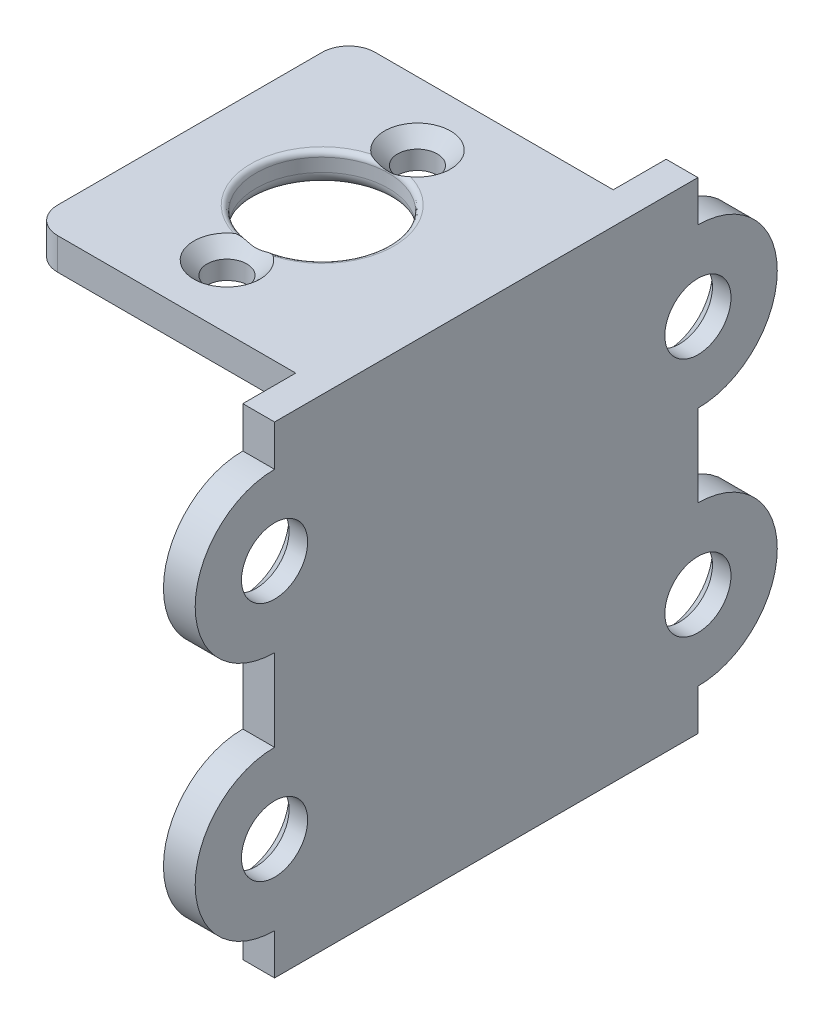
from build123d import *

# Parameters (mm, degrees)
SKETCH1_R           = 0.75
SKETCH1_R_2         = 2.5
BOSS_EXTRUDE3_DEPTH = 1.2
FILLET10_R          = 1
FILLET11_R          = 1
BOSS_EXTRUDE5_DEPTH = 1.2
SKETCH6_R           = 1.25
CUT_EXTRUDE3_DEPTH  = 1.2
SKETCH7_R           = 1.25
CUT_EXTRUDE4_DEPTH  = 1.2
CHAMFER5_SIZE       = 0.5
CHAMFER6_SIZE       = 0.5
FILLET13_R          = 0.5
FILLET14_R          = 0.2
CHAMFER7_SIZE       = 0.5
CHAMFER8_SIZE       = 0.5


with BuildPart() as part:
    # Sketch1 → Boss-Extrude3 (new body)
    with BuildSketch(Plane(origin=(0, 0, 0), x_dir=(1, 0, 0), z_dir=(0, 1, 0))):
        Polygon((5, 6), (0, 6), (-5, 6), (-5, -6), (5, -6), align=None)
        with Locations(Location((0, -3.6, 0), (0, 0, 270))):
            Circle(SKETCH1_R, mode=Mode.SUBTRACT)
        with Locations(Location((0, 0, 0), (0, 0, 270))):
            Circle(SKETCH1_R_2, mode=Mode.SUBTRACT)
        with Locations(Location((0, 3.6, 0), (0, 0, 270))):
            Circle(SKETCH1_R, mode=Mode.SUBTRACT)
    extrude(amount=BOSS_EXTRUDE3_DEPTH)

    # Fillet10
    fillet10_edges = [part.edges().sort_by_distance(p)[0] for p in [
        (-5, 0.6, 6),
    ]]
    fillet(fillet10_edges, radius=FILLET10_R)

    # Fillet11
    fillet11_edges = [part.edges().sort_by_distance(p)[0] for p in [
        (-5, 0.6, -6),
    ]]
    fillet(fillet11_edges, radius=FILLET11_R)

    # Sketch5 → Boss-Extrude5 (add)
    with BuildSketch(Plane(origin=(5, 0, 0), x_dir=(0, 0, -1), z_dir=(1, 0, 0))):
        with BuildLine():
            Line((6, 1.2), (-6, 1.2))
            Line((-6, 1.2), (-8, 1.2))
            Line((-8, 1.2), (-8, -0.35))
            ThreePointArc((-8, -0.35), (-11, -3.35), (-8, -6.35))
            Line((-8, -6.35), (-8, -9.45))
            ThreePointArc((-8, -9.45), (-11, -12.45), (-8, -15.45))
            Line((-8, -15.45), (-8, -17))
            Line((-8, -17), (8, -17))
            Line((8, -17), (8, -15.45))
            ThreePointArc((8, -15.45), (11, -12.45), (8, -9.45))
            Line((8, -9.45), (8, -6.35))
            ThreePointArc((8, -6.35), (11, -3.35), (8, -0.35))
            Line((8, -0.35), (8, 1.2))
            Line((8, 1.2), (6, 1.2))
        make_face()
    extrude(amount=BOSS_EXTRUDE5_DEPTH)

    # Sketch6 → Cut-Extrude3 (cut)
    with BuildSketch(Plane(origin=(6.2, 0, 0), x_dir=(0, 0, -1), z_dir=(1, 0, 0))):
        with Locations((8, -3.35)):
            Circle(SKETCH6_R)
        with Locations((8, -12.45)):
            Circle(SKETCH6_R)
    extrude(amount=-CUT_EXTRUDE3_DEPTH, mode=Mode.SUBTRACT)

    # Sketch7 → Cut-Extrude4 (cut)
    with BuildSketch(Plane.ZY.offset(-5)):
        with Locations((8, -12.45)):
            Circle(SKETCH7_R)
        with Locations((8, -3.35)):
            Circle(SKETCH7_R)
    extrude(amount=-CUT_EXTRUDE4_DEPTH, mode=Mode.SUBTRACT)

    # Chamfer5
    chamfer5_edges = [part.edges().sort_by_distance(p)[0] for p in [
        (5, -3.35, 6.75),
    ]]
    chamfer(chamfer5_edges, length=CHAMFER5_SIZE)

    # Chamfer6
    chamfer6_edges = [part.edges().sort_by_distance(p)[0] for p in [
        (5, -3.35, -6.75),
        (5, -12.45, -6.75),
        (5, -12.45, 6.75),
    ]]
    chamfer(chamfer6_edges, length=CHAMFER6_SIZE)

    # Fillet13
    # the kernel refuses this fillet: 0.5 mm, written as the material it takes off along each edge
    with BuildSketch(Plane(origin=(0, 0, 0), x_dir=(0, 0, 1), z_dir=(-1, 0, 0))) as fillet13_piece_1:
        with BuildLine():
            CenterArc((2.5 + FILLET13_R, FILLET13_R), FILLET13_R, 180, 90)
            Line((2.5, FILLET13_R), (2.5, 0))
            Line((2.5, 0), (2.5 + FILLET13_R, 0))
        make_face()
    revolve(axis=Axis((0, 0, 0), (0, 1, 0)), mode=Mode.SUBTRACT)

    # Fillet14
    fillet14_edges = [part.edges().sort_by_distance(p)[0] for p in [
        (0, 1.2, -2.5),
    ]]
    fillet(fillet14_edges, radius=FILLET14_R)

    # Chamfer7
    # the kernel refuses this chamfer: 0.5 mm, written as the material it takes off along each edge
    with BuildSketch(Plane(origin=(0, 1.2, 3.6), x_dir=(0, 0, 1), z_dir=(-1, 0, 0))) as chamfer7_piece_1:
        Polygon((0.75 + CHAMFER7_SIZE, 0), (0.75, -CHAMFER7_SIZE), (0.75, 0), align=None)
    revolve(axis=Axis((0, 1.2, 3.6), (0, 1, 0)), mode=Mode.SUBTRACT)

    # Chamfer8
    # the kernel refuses this chamfer: 0.5 mm, written as the material it takes off along each edge
    with BuildSketch(Plane(origin=(0, 1.2, -3.6), x_dir=(0, 0, 1), z_dir=(-1, 0, 0))) as chamfer8_piece_1:
        Polygon((0.75 + CHAMFER8_SIZE, 0), (0.75, -CHAMFER8_SIZE), (0.75, 0), align=None)
    revolve(axis=Axis((0, 1.2, -3.6), (0, 1, 0)), mode=Mode.SUBTRACT)


solid = part.part
